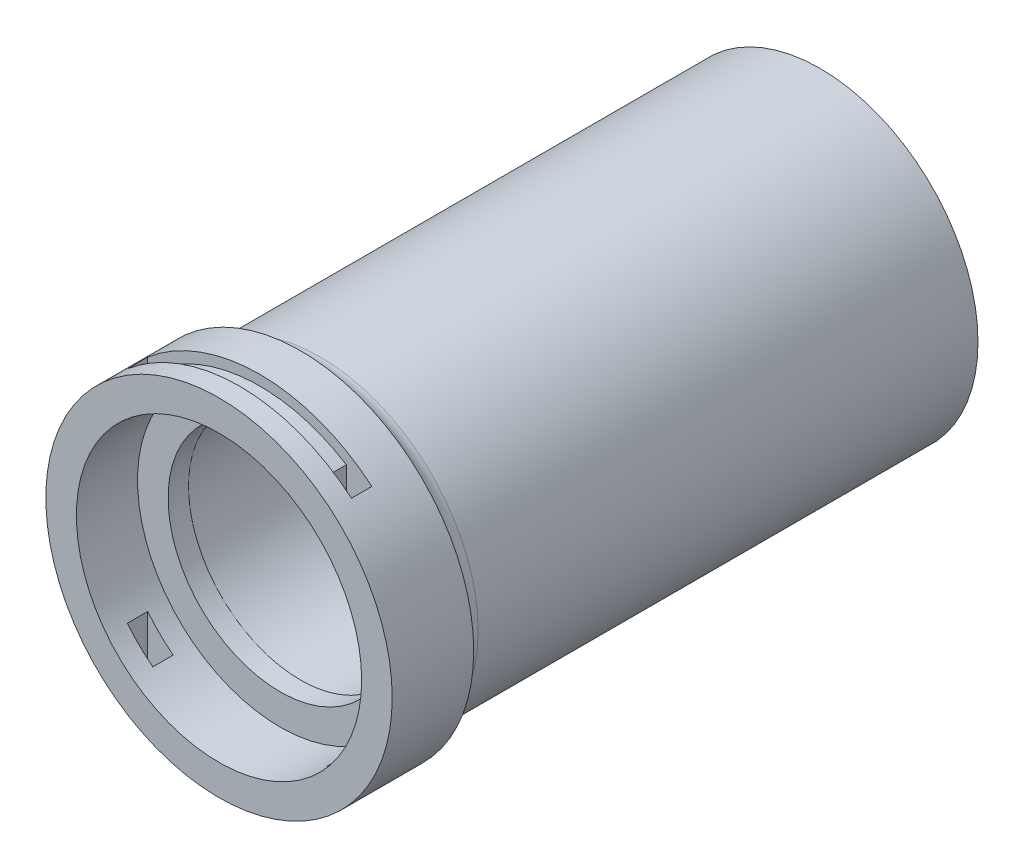
from build123d import *

# Parameters (mm, degrees)
SKETCH1_R                = 15.5
BOSS_EXTRUDE5_DEPTH      = 26
SKETCH3_R                = 5.625
CUT_EXTRUDE2_DEPTH       = 35.007352146
CUT_EXTRUDE3_DEPTH       = 28
CUT_EXTRUDE3_DEPTH_BACK  = 20
SKETCH4_R                = 11.1125
CUT_EXTRUDE6_START       = 6
SKETCH7_R                = 11
SKETCH7_R_2              = 9
CUT_EXTRUDE6_DEPTH       = 2
BOSS_EXTRUDE8_DEPTH      = 6
BOSS_EXTRUDE8_DEPTH_BACK = 2
BOSS_EXTRUDE8_START      = 20
SKETCH12_R               = 17
CUT_EXTRUDE10_START      = 18
SKETCH13_R               = 11
CUT_EXTRUDE10_DEPTH      = 18.411862419
FILLET2_R                = 2
CUT_EXTRUDE11_START      = 26
SKETCH14_R               = 14
CUT_EXTRUDE11_DEPTH      = 6
SKETCH15_R               = 0.5
CUT_EXTRUDE14_DEPTH      = 36.411862419
SKETCH18_W               = 2.5
SKETCH18_H               = 2
CUT_EXTRUDE15_DEPTH      = 20
CUT_EXTRUDE16_DEPTH      = 2
BOSS_EXTRUDE9_START      = 33
SKETCH26_R               = 15.5
SKETCH26_R_2             = 5.625
SKETCH26_R_3             = 0.5
BOSS_EXTRUDE9_DEPTH      = 33


with BuildPart() as part:
    # Sketch1 → Boss-Extrude5 (new body)
    with BuildSketch(Plane.XY):
        Circle(SKETCH1_R)
    extrude(amount=BOSS_EXTRUDE5_DEPTH)

    # Sketch3 → Cut-Extrude2 (cut, through all)
    with BuildSketch(Plane.XY.offset(26)):
        Circle(SKETCH3_R)
    extrude(amount=-CUT_EXTRUDE2_DEPTH, mode=Mode.SUBTRACT)

    # Sketch4 → Cut-Extrude3 (cut, two sides: drawn at the far end of the back side and taken through both)
    with BuildSketch(Plane.XY.offset(26).offset(-CUT_EXTRUDE3_DEPTH_BACK)):
        Circle(SKETCH4_R)
    extrude(amount=CUT_EXTRUDE3_DEPTH + CUT_EXTRUDE3_DEPTH_BACK, mode=Mode.SUBTRACT)

    # Sketch7 → Cut-Extrude6 (cut)
    with BuildSketch(Plane.XY.offset(CUT_EXTRUDE6_START)):
        Circle(SKETCH7_R)
        Circle(SKETCH7_R_2, mode=Mode.SUBTRACT)
    extrude(amount=-CUT_EXTRUDE6_DEPTH, mode=Mode.SUBTRACT)

    # Sketch12 → Boss-Extrude8 (add, two sides: drawn at the far end of the back side and taken through both)
    with BuildSketch(Plane.XY.offset(BOSS_EXTRUDE8_START - BOSS_EXTRUDE8_DEPTH_BACK)):
        Circle(SKETCH12_R)
    extrude(amount=BOSS_EXTRUDE8_DEPTH + BOSS_EXTRUDE8_DEPTH_BACK)

    # Sketch13 → Cut-Extrude10 (cut, through all)
    with BuildSketch(Plane.XY.offset(CUT_EXTRUDE10_START)):
        Circle(SKETCH13_R)
    extrude(amount=CUT_EXTRUDE10_DEPTH, mode=Mode.SUBTRACT)

    # Fillet2
    # the kernel refuses this fillet: 2 mm, written as the material it adds along each edge
    with BuildSketch(Plane(origin=(0, 0, 18), x_dir=(1, 0, 0), z_dir=(0, 1, 0))) as fillet2_piece_1:
        with BuildLine():
            CenterArc((17.5, 1.936491673), FILLET2_R, 180, 75.522487814)
            Line((17, 0), (16.99, -0.038729833))
            ThreePointArc((16.99, -0.038729833), (16.25, -0.04), (15.5, -0.04))
            Line((15.5, -0.04), (15.46, 0))
            Line((15.46, 0), (15.46, 1.936491673))
            Line((15.46, 1.936491673), (15.5, 1.936491673))
        make_face()
    revolve(axis=Axis((0, 0, 18), (0, 0, -1)))

    # Sketch14 → Cut-Extrude11 (cut)
    with BuildSketch(Plane.XY.offset(CUT_EXTRUDE11_START)):
        Circle(SKETCH14_R)
    extrude(amount=-CUT_EXTRUDE11_DEPTH, mode=Mode.SUBTRACT)

    # Sketch15 → Cut-Extrude14 (cut, through all)
    with BuildSketch(Plane.XY):
        with Locations((0, 10)):
            Circle(SKETCH15_R)
        with Locations((0, -10)):
            Circle(SKETCH15_R)
        with Locations((10, 0)):
            Circle(SKETCH15_R)
        with Locations((-10, 0)):
            Circle(SKETCH15_R)
    extrude(amount=CUT_EXTRUDE14_DEPTH, mode=Mode.SUBTRACT)

    # Sketch18 → Cut-Extrude15 (cut, symmetric)
    with BuildSketch(Plane(origin=(0, 0, 0), x_dir=(1, 0, 0), z_dir=(0, 1, 0))):
        with Locations((-9.75, -23)):
            Rectangle(SKETCH18_W, SKETCH18_H)
        with Locations((9.75, -23)):
            Rectangle(SKETCH18_W, SKETCH18_H)
    extrude(amount=CUT_EXTRUDE15_DEPTH, both=True, mode=Mode.SUBTRACT)

    # Sketch23 → Cut-Extrude16 (cut)
    with BuildSketch(Plane(origin=(0, 0, 24), x_dir=(-1, 0, 0), z_dir=(0, 0, -1))):
        with BuildLine():
            Line((9.719197711, 13.947659153), (9.147480199, 13.127208615))
            ThreePointArc((9.147480199, 13.127208615), (0, 16), (-9.147480199, 13.127208615))
            Line((-9.147480199, 13.127208615), (-9.719197711, 13.947659153))
            ThreePointArc((-9.719197711, 13.947659153), (0, 17), (9.719197711, 13.947659153))
        make_face()
        with BuildLine():
            Line((-9.147480199, -13.127208615), (-9.719197711, -13.947659153))
            ThreePointArc((-9.719197711, -13.947659153), (0, -17), (9.719197711, -13.947659153))
            Line((9.719197711, -13.947659153), (9.147480199, -13.127208615))
            ThreePointArc((9.147480199, -13.127208615), (0, -16), (-9.147480199, -13.127208615))
        make_face()
    extrude(amount=CUT_EXTRUDE16_DEPTH, mode=Mode.SUBTRACT)

    # Sketch26 → Boss-Extrude9 (add)
    with BuildSketch(Plane(origin=(0, 0, 0), x_dir=(-1, 0, 0), z_dir=(0, 0, -1)).offset(BOSS_EXTRUDE9_START)):
        Circle(SKETCH26_R)
        with Locations(Location((0, 0, 0), (0, 0, 180))):
            Circle(SKETCH26_R_2, mode=Mode.SUBTRACT)
        with Locations((-10, 0)):
            Circle(SKETCH26_R_3, mode=Mode.SUBTRACT)
        with Locations((0, 10)):
            Circle(SKETCH26_R_3, mode=Mode.SUBTRACT)
        with Locations((10, 0)):
            Circle(SKETCH26_R_3, mode=Mode.SUBTRACT)
        with Locations((0, -10)):
            Circle(SKETCH26_R_3, mode=Mode.SUBTRACT)
    extrude(amount=-BOSS_EXTRUDE9_DEPTH)


solid = part.part
